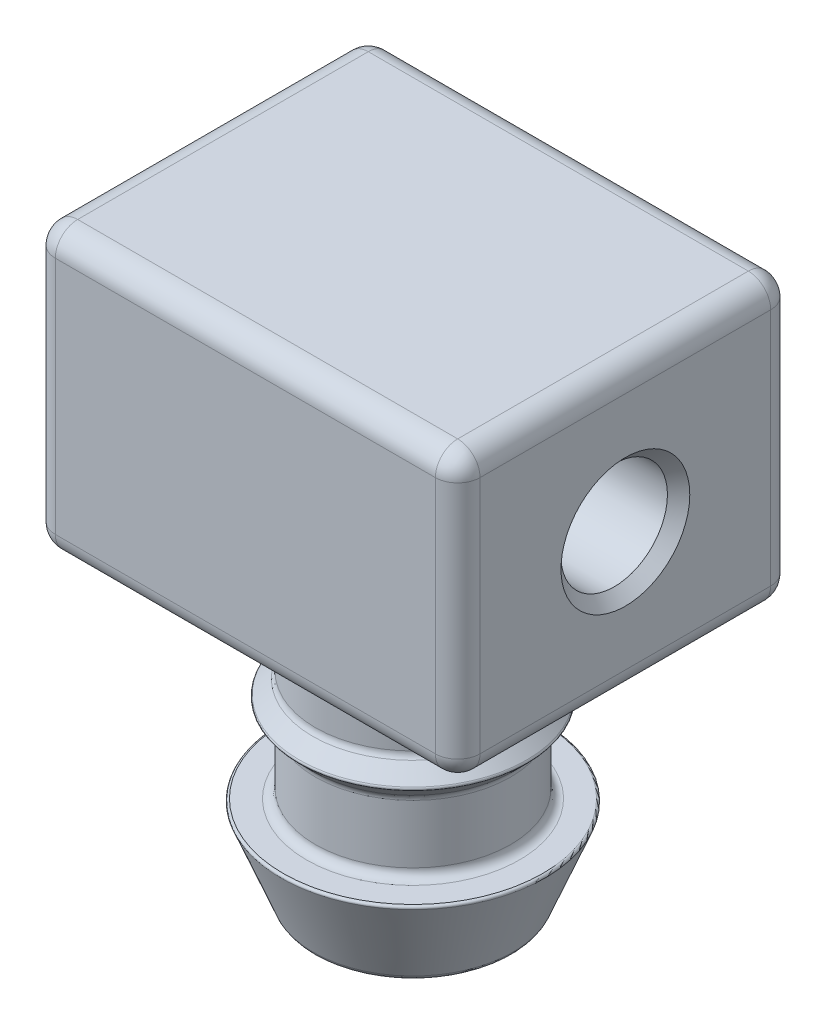
from build123d import *

# Parameters (mm, degrees)
SKETCH4_W               = 19
SKETCH4_H               = 15
BOSS_EXTRUDE1_DEPTH     = 12.7
CUT_EXTRUDE1_DEPTH      = 18.543944824
CUT_EXTRUDE1_DEPTH_BACK = 18.543944824
SKETCH2_R               = 2.38125
FILLET3_R               = 0.396875
FILLET4_R               = 0.09921875
CHAMFER1_SIZE           = 0.5
FILLET5_R               = 1


with BuildPart() as part:
    # Sketch1 → Revolve1 (revolve)
    with BuildSketch(Plane.XY):
        Polygon((0, 12.7), (0, -12.7), (4.365625, -12.7), (5.953125, -8.73125), (4.365625, -8.73125), (4.365625, -5.55625), (5.159375, -4.7625), (4.365625, -3.96875), (4.365625, 0), (5.3975, 0), (5.3975, 3.96875), (3.81, 3.96875), (3.81, 8.73125), (5.3975, 8.73125), (5.3975, 12.7), align=None)
    revolve(axis=Axis((0, 7.737700229, 0), (0, -1, 0)))

    # Sketch4 → Boss-Extrude1 (add)
    with BuildSketch(Plane(origin=(0, 12.7, 0), x_dir=(1, 0, 0), z_dir=(0, 1, 0))):
        Rectangle(SKETCH4_W, SKETCH4_H)
    extrude(amount=-BOSS_EXTRUDE1_DEPTH)

    # Sketch2 → Cut-Extrude1 (cut, two sides: drawn at the far end of the back side and taken through both)
    with BuildSketch(Plane(origin=(0, 0, 0), x_dir=(0, 0, -1), z_dir=(1, 0, 0)).offset(-CUT_EXTRUDE1_DEPTH_BACK)):
        with Locations((0, 6.35)):
            Circle(SKETCH2_R)
    extrude(amount=CUT_EXTRUDE1_DEPTH + CUT_EXTRUDE1_DEPTH_BACK, mode=Mode.SUBTRACT)

    # Fillet3
    fillet3_edges = [part.edges().sort_by_distance(p)[0] for p in [
        (-4.365625, -12.7, 0),
        (-4.365625, -8.73125, 0),
        (-4.365625, 0, 0),
        (-4.365625, -3.96875, 0),
        (-4.365625, -5.55625, 0),
    ]]
    fillet(fillet3_edges, radius=FILLET3_R)

    # Fillet4
    fillet4_edges = [part.edges().sort_by_distance(p)[0] for p in [
        (-5.953125, -8.73125, 0),
        (-5.159375, -4.7625, 0),
    ]]
    fillet(fillet4_edges, radius=FILLET4_R)

    # Chamfer1
    chamfer1_edges = [part.edges().sort_by_distance(p)[0] for p in [
        (9.5, 6.35, 2.38125),
        (-9.5, 6.35, 2.38125),
    ]]
    chamfer(chamfer1_edges, length=CHAMFER1_SIZE)

    # Fillet5
    fillet5_edges = [part.edges().sort_by_distance(p)[0] for p in [
        (0, 12.7, 7.5),
        (-9.5, 12.7, 0),
        (9.5, 12.7, 0),
        (-9.5, 6.35, -7.5),
        (0, 0, -7.5),
        (9.5, 6.35, -7.5),
        (0, 12.7, -7.5),
        (9.5, 0, 0),
        (-9.5, 0, 0),
        (-9.5, 6.35, 7.5),
        (0, 0, 7.5),
        (9.5, 6.35, 7.5),
    ]]
    fillet(fillet5_edges, radius=FILLET5_R)


solid = part.part
